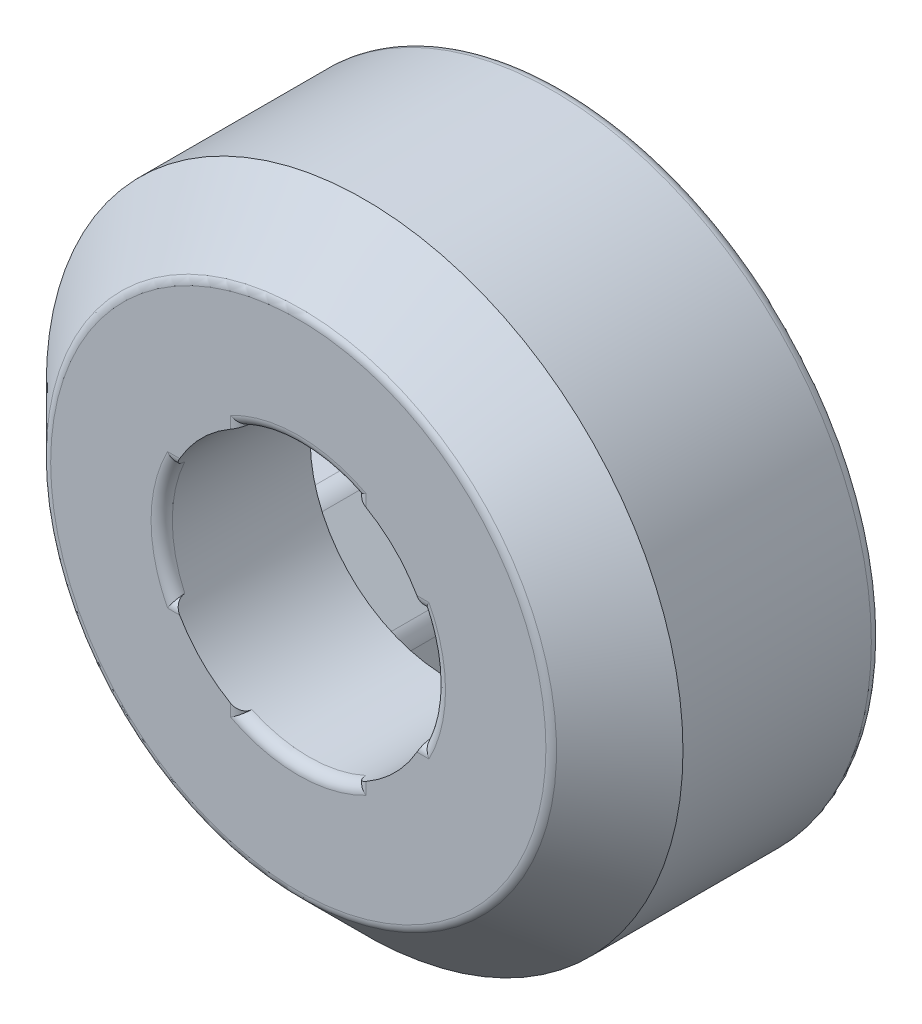
from build123d import *

# Parameters (mm, degrees)
CUT_EXTRUDE1_DEPTH      = 10.178779875
CUT_EXTRUDE1_DEPTH_BACK = 10.178779875
CUT_EXTRUDE2_DEPTH      = 2.2
FILLET1_R               = 0.5
CHAMFER1_SIZE           = 1.25
FILLET2_R               = 0.2
CUT_EXTRUDE3_DEPTH      = 9.935323193
CUT_EXTRUDE3_DEPTH_BACK = 9.935323193
SKETCH5_R               = 2.575


with BuildPart() as part:
    # Sketch3 → Revolve1 (revolve)
    with BuildSketch(Plane(origin=(0, 0, 0), x_dir=(0, 0, -1), z_dir=(1, 0, 0))):
        Polygon((-1.5, 0), (3.5, 0), (3.5, 6), (1, 6), (-1.5, 6), (-1.5, 3.75), align=None)
    revolve(axis=Axis((0, 0, 1.5), (0, 0, -1)))

    # Sketch2 → Cut-Extrude1 (cut, two sides: drawn at the far end of the back side and taken through both)
    with BuildSketch(Plane.XY.offset(-CUT_EXTRUDE1_DEPTH_BACK)):
        with BuildLine():
            Line((1.0775, 1.0775), (2.338721606, 1.0775))
            ThreePointArc((2.338721606, 1.0775), (2.575, 0), (2.338721606, -1.0775))
            Line((2.338721606, -1.0775), (1.0775, -1.0775))
            Line((1.0775, -1.0775), (1.0775, -2.338721606))
            ThreePointArc((1.0775, -2.338721606), (0, -2.575), (-1.0775, -2.338721606))
            Line((-1.0775, -2.338721606), (-1.0775, -1.0775))
            Line((-1.0775, -1.0775), (-2.338721606, -1.0775))
            ThreePointArc((-2.338721606, -1.0775), (-2.575, 0), (-2.338721606, 1.0775))
            Line((-2.338721606, 1.0775), (-1.0775, 1.0775))
            Line((-1.0775, 1.0775), (-1.0775, 2.338721606))
            ThreePointArc((-1.0775, 2.338721606), (0, 2.575), (1.0775, 2.338721606))
            Line((1.0775, 2.338721606), (1.0775, 1.0775))
        make_face()
    extrude(amount=CUT_EXTRUDE1_DEPTH + CUT_EXTRUDE1_DEPTH_BACK, mode=Mode.SUBTRACT)

    # Sketch4 → Cut-Extrude2 (cut)
    with BuildSketch(Plane(origin=(0, 0, -3.5), x_dir=(-1, 0, 0), z_dir=(0, 0, -1))):
        with BuildLine():
            Line((-1.5, 4.769696007), (-1.5, 3.096194078))
            Line((-1.5, 3.096194078), (-3.096194078, 1.5))
            Line((-3.096194078, 1.5), (-4.769696007, 1.5))
            ThreePointArc((-4.769696007, 1.5), (-4.942088629, 0.758788496), (-5, 0))
            ThreePointArc((-5, 0), (-4.942088629, -0.758788496), (-4.769696007, -1.5))
            Line((-4.769696007, -1.5), (-3.096194078, -1.5))
            Line((-3.096194078, -1.5), (-1.5, -3.096194078))
            Line((-1.5, -3.096194078), (-1.5, -4.769696007))
            ThreePointArc((-1.5, -4.769696007), (-0.758788496, -4.942088629), (0, -5))
            ThreePointArc((0, -5), (0.758788496, -4.942088629), (1.5, -4.769696007))
            Line((1.5, -4.769696007), (1.5, -3.096194078))
            Line((1.5, -3.096194078), (3.096194078, -1.5))
            Line((3.096194078, -1.5), (4.769696007, -1.5))
            ThreePointArc((4.769696007, -1.5), (4.942088629, -0.758788496), (5, 0))
            ThreePointArc((5, 0), (4.942088629, 0.758788496), (4.769696007, 1.5))
            Line((4.769696007, 1.5), (3.096194078, 1.5))
            Line((3.096194078, 1.5), (1.5, 3.096194078))
            Line((1.5, 3.096194078), (1.5, 4.769696007))
            ThreePointArc((1.5, 4.769696007), (0.758788496, 4.942088629), (0, 5))
            ThreePointArc((0, 5), (-0.758788496, 4.942088629), (-1.5, 4.769696007))
        make_face()
    extrude(amount=-CUT_EXTRUDE2_DEPTH, mode=Mode.SUBTRACT)

    # Fillet1
    fillet1_edges = [part.edges().sort_by_distance(p)[0] for p in [
        (3.096194078, -1.5, -2.4),
        (1.5, -3.096194078, -2.4),
        (-1.5, -3.096194078, -2.4),
        (-3.096194078, -1.5, -2.4),
        (-3.096194078, 1.5, -2.4),
        (-1.5, 3.096194078, -2.4),
        (1.5, 3.096194078, -2.4),
        (3.096194078, 1.5, -2.4),
    ]]
    fillet(fillet1_edges, radius=FILLET1_R)

    # Chamfer1
    chamfer1_edges = [part.edges().sort_by_distance(p)[0] for p in [
        (0, -6, 1.5),
    ]]
    chamfer(chamfer1_edges, length=CHAMFER1_SIZE)

    # Fillet2
    fillet2_edges = [part.edges().sort_by_distance(p)[0] for p in [
        (-1.0775, -1.708110803, 1.5),
        (0, -2.575, 1.5),
        (1.0775, -1.708110803, 1.5),
        (1.708110803, -1.0775, 1.5),
        (2.575, 0, 1.5),
        (1.708110803, 1.0775, 1.5),
        (1.0775, 1.708110803, 1.5),
        (0, 2.575, 1.5),
        (-1.0775, 1.708110803, 1.5),
        (-1.708110803, 1.0775, 1.5),
        (-2.575, 0, 1.5),
        (-1.708110803, -1.0775, 1.5),
        (0, -6, -3.5),
        (1.538060234, -3.111959143, -3.5),
        (1.5, -4.036498433, -3.5),
        (0, -5, -3.5),
        (-1.5, -4.036498433, -3.5),
        (-1.538060234, -3.111959143, -3.5),
        (-2.298097039, -2.298097039, -3.5),
        (-3.111959143, -1.538060234, -3.5),
        (-4.036498433, -1.5, -3.5),
        (-5, 0, -3.5),
        (-4.036498433, 1.5, -3.5),
        (-3.111959143, 1.538060234, -3.5),
        (-2.298097039, 2.298097039, -3.5),
        (-1.538060234, 3.111959143, -3.5),
        (-1.5, 4.036498433, -3.5),
        (0, 5, -3.5),
        (1.5, 4.036498433, -3.5),
        (1.538060234, 3.111959143, -3.5),
        (2.298097039, 2.298097039, -3.5),
        (3.111959143, 1.538060234, -3.5),
        (4.036498433, 1.5, -3.5),
        (5, 0, -3.5),
        (4.036498433, -1.5, -3.5),
        (3.111959143, -1.538060234, -3.5),
        (2.298097039, -2.298097039, -3.5),
        (0, -4.75, 1.5),
    ]]
    fillet(fillet2_edges, radius=FILLET2_R)

    # Sketch5 → Cut-Extrude3 (cut, two sides: drawn at the far end of the back side and taken through both)
    with BuildSketch(Plane(origin=(0, 0, -1.3), x_dir=(-1, 0, 0), z_dir=(0, 0, -1)).offset(-CUT_EXTRUDE3_DEPTH_BACK)):
        Circle(SKETCH5_R)
    extrude(amount=CUT_EXTRUDE3_DEPTH + CUT_EXTRUDE3_DEPTH_BACK, mode=Mode.SUBTRACT)


solid = part.part
